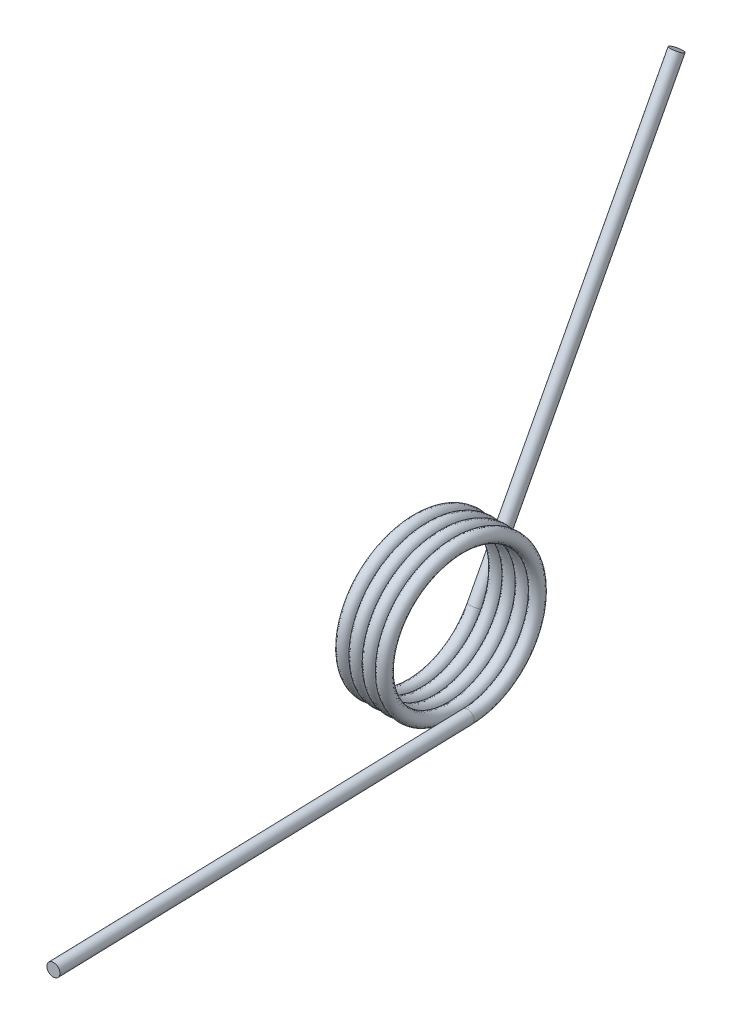
from build123d import *

# Parameters (mm, degrees)
SWEEP1_PITCH   = 0.7874
SKETCH4_R      = 0.381
EXTRUDE1_DEPTH = 25.4
SKETCH5_R      = 0.381
EXTRUDE2_DEPTH = 25.4


with BuildPart() as part:
    # Sweep1: the profile of Sketch3 screwed along a left-hand helix of 4.166667 turns, 6 arcs to a turn; built about Z, then put on its axis
    sweep1_z = Axis((0, 0, 0), (0, 0, 1))
    sweep1_corners = [(4.364952965, -0.01095332, -0.380739609), (4.736997132, 0.000254581, 0.008849304), (4.347247035, 0.01095332, 0.380739609), (3.975202868, -0.000254581, -0.008849304)]
    with BuildLine(mode=Mode.PRIVATE) as sweep1_profile:
        ThreePointArc((4.364952965, -0.01095332, -0.380739609), (4.631694937, -0.00756515, -0.262966156), (4.736997132, 0.000254581, 0.008849304))
        ThreePointArc((4.736997132, 0.000254581, 0.008849304), (4.619174953, 0.007925183, 0.275480962), (4.347247035, 0.01095332, 0.380739609))
        ThreePointArc((4.347247035, 0.01095332, 0.380739609), (4.080505063, 0.00756515, 0.262966156), (3.975202868, -0.000254581, -0.008849304))
        ThreePointArc((3.975202868, -0.000254581, -0.008849304), (4.093025047, -0.007925183, -0.275480962), (4.364952965, -0.01095332, -0.380739609))
    sweep1_cap = Face(sweep1_profile.wire())
    sweep1_arcs = [((4.364952965, -0.01095332, -0.380739609), (4.745850097, -0.010698738, -0.371890305), (4.736997132, 0.000254581, 0.008849304), (1, 0.7071067811865476, 1)), ((4.736997132, 0.000254581, 0.008849304), (4.728144167, 0.011207901, 0.389588913), (4.347247035, 0.01095332, 0.380739609), (1, 0.7071067811865476, 1)), ((4.347247035, 0.01095332, 0.380739609), (3.966349903, 0.010698738, 0.371890305), (3.975202868, -0.000254581, -0.008849304), (1, 0.7071067811865476, 1)), ((3.975202868, -0.000254581, -0.008849304), (3.984055833, -0.011207901, -0.389588913), (4.364952965, -0.01095332, -0.380739609), (1, 0.7071067811865476, 1))]  # start, shoulder, end, weights
    sweep1_turn_angles = [0, -30, -60, -90, -120, -150, -180, -210, -240, -270, -300, -330, -360]
    sweep1_turn_weights = [1, 0.8660254037844387, 1, 0.8660254037844387, 1, 0.8660254037844387, 1, 0.8660254037844387, 1, 0.8660254037844387, 1, 0.8660254037844387, 1]
    sweep1_turn_sides = [Face.make_bezier_surface([[Vector(p[j][0], p[j][1], 0).rotate(sweep1_z, sweep1_turn_angles[2 * i + k]) / sweep1_turn_weights[2 * i + k] + Vector(0, 0, p[j][2] + -SWEEP1_PITCH * sweep1_turn_angles[2 * i + k] / 360) for k in range(3)] for j in range(3)], [[p[3][j] * sweep1_turn_weights[2 * i + k] for k in range(3)] for j in range(3)]) for p in sweep1_arcs for i in range(6)]
    sweep1_last_angles = [-1440, -1470, -1500]
    sweep1_last_weights = [1, 0.8660254037844208, 1]
    sweep1_last_sides = [Face.make_bezier_surface([[Vector(p[j][0], p[j][1], 0).rotate(sweep1_z, sweep1_last_angles[2 * i + k]) / sweep1_last_weights[2 * i + k] + Vector(0, 0, p[j][2] + -SWEEP1_PITCH * sweep1_last_angles[2 * i + k] / 360) for k in range(3)] for j in range(3)], [[p[3][j] * sweep1_last_weights[2 * i + k] for k in range(3)] for j in range(3)]) for p in sweep1_arcs for i in range(1)]
    sweep1 = Plane(origin=(0, 0, 0), x_dir=(0, -1, 0), z_dir=(-1, 0, 0)) * Solid(Shell([*[p.moved(Location((0, 0, SWEEP1_PITCH * i))) for i in range(4) for p in sweep1_turn_sides], *sweep1_last_sides, sweep1_cap, sweep1_cap.rotate(sweep1_z, -1500).moved(Location((0, 0, -SWEEP1_PITCH * -1500 / 360)))]))
    add(sweep1)

    # Sketch4 → Extrude1 (add)
    with BuildSketch(Plane(origin=(0, 0, 0), x_dir=(-0.9993165588321744, 0.023236129092747946, 0.028748870388358348), z_dir=(0.028756634544423593, -1.0606099332122199e-14, 0.999586442469924))):
        with Locations(Location((-0.101218902, 4.354923873, 0), (0, 0, 1.33145196))):
            Circle(SKETCH4_R)
    extrude(amount=EXTRUDE1_DEPTH)

    # Sketch5 → Extrude2 (add)
    with BuildSketch(Plane(origin=(-0.002713066, 0.081672005, -0.047153354), x_dir=(0.9995864419308154, 0.02492039753313022, -0.014349874385632802), z_dir=(-0.028756634544423593, 0.8656672524575096, -0.499793221234887))):
        with Locations(Location((-3.279619586, 4.35599229, 0), (0, 0, 180.001881766))):
            Circle(SKETCH5_R)
    extrude(amount=EXTRUDE2_DEPTH)


solid = part.part
